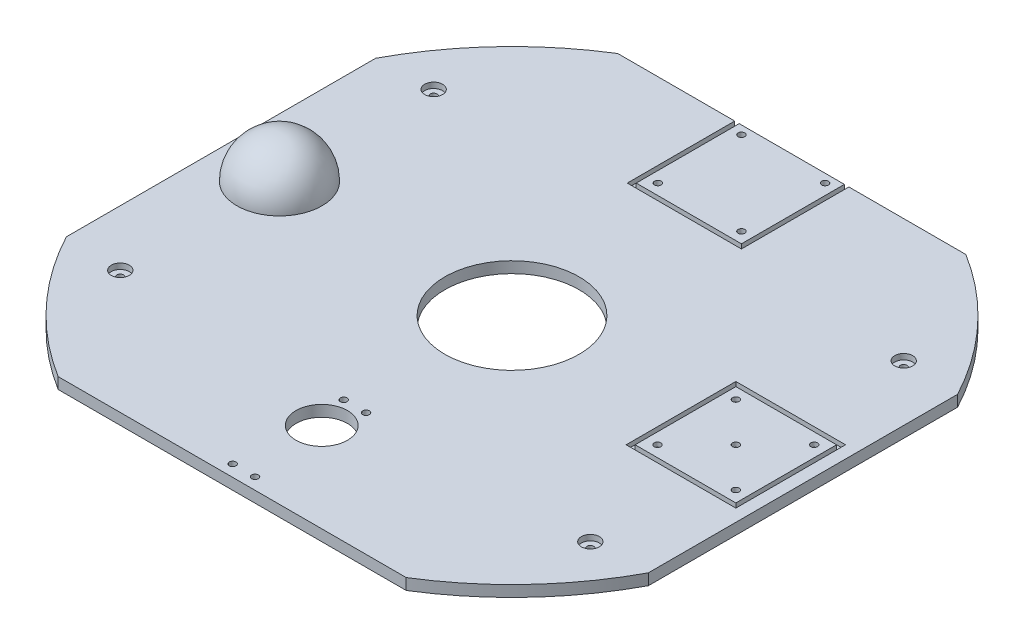
from build123d import *

# Parameters (mm, degrees)
SKETCH_1_W           = 200
SKETCH_1_H           = 150
EXTRUDE_1_DEPTH      = 5
SKETCH_2_W           = 280
SKETCH_2_H           = 250
SKETCH_2_R           = 1.5
EXTRUDE_2_DEPTH      = 5
SKETCH_3_R           = 11.5
CUT_EXTRUDE_1_DEPTH  = 5
SKETCH_4_R           = 3
SKETCH_4_R_2         = 1.5
EXTRUDE_3_DEPTH      = 13
CUT_EXTRUDE_4_REACH  = 190.133
SKETCH_8_R           = 1.5
CUT_EXTRUDE_5_REACH  = 190.133
SKETCH_9_W           = 10
SKETCH_9_H           = 250
SKETCH_10_W          = 41.454704644
SKETCH_10_H          = 62.998147515
CUT_EXTRUDE_6_DEPTH  = 13
CUT_EXTRUDE_7_REACH  = 182.416
SKETCH_11_R          = 1.5
CUT_EXTRUDE_8_DEPTH  = 2
CUT_EXTRUDE_9_REACH  = 182.416
SKETCH_13_R          = 30
CUT_EXTRUDE_10_REACH = 182.416
SKETCH_17_R          = 4
CUT_EXTRUDE_11_DEPTH = 2.5
SKETCH_18_W          = 49
SKETCH_18_H          = 49
SKETCH_18_W_2        = 45
SKETCH_18_H_2        = 45
CUT_EXTRUDE_12_DEPTH = 2
SKETCH_19_R          = 1.5
CUT_EXTRUDE_13_DEPTH = 2


# Read off the part's stored shape, not the designer's step: 旋转4
with BuildPart() as part:
    # 草图1 → 凸台-拉伸1 (new body)
    with BuildSketch(Plane(origin=(0, 0, 0), x_dir=(1, 0, 0), z_dir=(0, 1, 0))):
        Rectangle(SKETCH_1_W, SKETCH_1_H)
    extrude(amount=EXTRUDE_1_DEPTH)

    # 草图2 → 凸台-拉伸2 (add)
    with BuildSketch(Plane(origin=(0, 5, 0), x_dir=(1, 0, 0), z_dir=(0, 1, 0))):
        Rectangle(SKETCH_2_W, SKETCH_2_H)
        with Locations(Location((-105, 70, 0), (0, 0, 270))):
            Circle(SKETCH_2_R, mode=Mode.SUBTRACT)
        with Locations(Location((-105, -70, 0), (0, 0, 270))):
            Circle(SKETCH_2_R, mode=Mode.SUBTRACT)
        with Locations(Location((105, 70, 0), (0, 0, 270))):
            Circle(SKETCH_2_R, mode=Mode.SUBTRACT)
        with Locations(Location((105, -70, 0), (0, 0, 270))):
            Circle(SKETCH_2_R, mode=Mode.SUBTRACT)
    extrude(amount=-EXTRUDE_2_DEPTH)

    # 草图3 → 切除-拉伸1 (cut)
    with BuildSketch(Plane(origin=(0, 5, 0), x_dir=(1, 0, 0), z_dir=(0, 1, 0))):
        with Locations(Location((0, -85, 0), (0, 0, 270))):
            Circle(SKETCH_3_R)
    extrude(amount=-CUT_EXTRUDE_1_DEPTH, mode=Mode.SUBTRACT)

    # 草图4 → 凸台-拉伸3 (add)
    # profile 1 of 4: a face of its own
    with BuildSketch(Plane.XZ):
        with Locations(Location((-5, 119.8, 0), (0, 0, 90))):
            Circle(SKETCH_4_R)
        with Locations(Location((-5, 119.8, 0), (0, 0, 90))):
            Circle(SKETCH_4_R_2, mode=Mode.SUBTRACT)
    # profile 2 of 4: a face of its own
    with BuildSketch(Plane.XZ):
        with Locations(Location((5, 119.8, 0), (0, 0, 90))):
            Circle(SKETCH_4_R)
        with Locations(Location((5, 119.8, 0), (0, 0, 90))):
            Circle(SKETCH_4_R_2, mode=Mode.SUBTRACT)
    # profile 3 of 4: a face of its own
    with BuildSketch(Plane.XZ):
        with Locations(Location((5, 70.2, 0), (0, 0, 90))):
            Circle(SKETCH_4_R)
        with Locations(Location((5, 70.2, 0), (0, 0, 90))):
            Circle(SKETCH_4_R_2, mode=Mode.SUBTRACT)
    # profile 4 of 4: a face of its own
    with BuildSketch(Plane.XZ):
        with Locations(Location((-5, 70.2, 0), (0, 0, 90))):
            Circle(SKETCH_4_R)
        with Locations(Location((-5, 70.2, 0), (0, 0, 90))):
            Circle(SKETCH_4_R_2, mode=Mode.SUBTRACT)
    extrude(amount=EXTRUDE_3_DEPTH)

    # 草图8 → 切除-拉伸4 (cut, up to next)
    with BuildSketch(Plane.XZ, mode=Mode.PRIVATE) as cut_extrude_4_sk1:
        with Locations(Location((5, 119.8, 0), (0, 0, 90))):
            Circle(SKETCH_8_R)
    cut_extrude_4_tool1 = extrude(cut_extrude_4_sk1.sketch, amount=-CUT_EXTRUDE_4_REACH, mode=Mode.PRIVATE) & part.part
    # 草图8 → 切除-拉伸4 (cut, up to next)
    with BuildSketch(Plane.XZ, mode=Mode.PRIVATE) as cut_extrude_4_sk2:
        with Locations(Location((5, 70.2, 0), (0, 0, 90))):
            Circle(SKETCH_8_R)
    cut_extrude_4_tool2 = extrude(cut_extrude_4_sk2.sketch, amount=-CUT_EXTRUDE_4_REACH, mode=Mode.PRIVATE) & part.part
    # 草图8 → 切除-拉伸4 (cut, up to next)
    with BuildSketch(Plane.XZ, mode=Mode.PRIVATE) as cut_extrude_4_sk3:
        with Locations(Location((-5, 119.8, 0), (0, 0, 90))):
            Circle(SKETCH_8_R)
    cut_extrude_4_tool3 = extrude(cut_extrude_4_sk3.sketch, amount=-CUT_EXTRUDE_4_REACH, mode=Mode.PRIVATE) & part.part
    # 草图8 → 切除-拉伸4 (cut, up to next)
    with BuildSketch(Plane.XZ, mode=Mode.PRIVATE) as cut_extrude_4_sk4:
        with Locations(Location((-5, 70.2, 0), (0, 0, 90))):
            Circle(SKETCH_8_R)
    cut_extrude_4_tool4 = extrude(cut_extrude_4_sk4.sketch, amount=-CUT_EXTRUDE_4_REACH, mode=Mode.PRIVATE) & part.part
    add(cut_extrude_4_tool1.solids().sort_by_distance((5, 0, 119.8))[0], mode=Mode.SUBTRACT)
    add(cut_extrude_4_tool2.solids().sort_by_distance((5, 0, 70.2))[0], mode=Mode.SUBTRACT)
    add(cut_extrude_4_tool3.solids().sort_by_distance((-5, 0, 119.8))[0], mode=Mode.SUBTRACT)
    add(cut_extrude_4_tool4.solids().sort_by_distance((-5, 0, 70.2))[0], mode=Mode.SUBTRACT)

    # 草图9 → 切除-拉伸5 (cut, up to next)
    with BuildSketch(Plane.XZ, mode=Mode.PRIVATE) as cut_extrude_5_sk1:
        with Locations((-135, 0)):
            Rectangle(SKETCH_9_W, SKETCH_9_H)
    cut_extrude_5_tool1 = extrude(cut_extrude_5_sk1.sketch, amount=-CUT_EXTRUDE_5_REACH, mode=Mode.PRIVATE) & part.part
    # 草图9 → 切除-拉伸5 (cut, up to next)
    with BuildSketch(Plane.XZ, mode=Mode.PRIVATE) as cut_extrude_5_sk2:
        with Locations((135, 0)):
            Rectangle(SKETCH_9_W, SKETCH_9_H)
    cut_extrude_5_tool2 = extrude(cut_extrude_5_sk2.sketch, amount=-CUT_EXTRUDE_5_REACH, mode=Mode.PRIVATE) & part.part
    add(cut_extrude_5_tool1.solids().sort_by_distance((-135, 0, 0))[0], mode=Mode.SUBTRACT)
    add(cut_extrude_5_tool2.solids().sort_by_distance((135, 0, 0))[0], mode=Mode.SUBTRACT)

    # 草图10 → 切除-拉伸6 (cut)
    with BuildSketch(Plane.XZ):
        with Locations((1.571094054, 93.500926243)):
            Rectangle(SKETCH_10_W, SKETCH_10_H)
    extrude(amount=CUT_EXTRUDE_6_DEPTH, mode=Mode.SUBTRACT)

    # 草图11 → 切除-拉伸7 (cut, up to next)
    with BuildSketch(Plane(origin=(0, 5, 0), x_dir=(1, 0, 0), z_dir=(0, 1, 0)), mode=Mode.PRIVATE) as cut_extrude_7_sk1:
        with Locations(Location((-18.68, 121.18, 0), (0, 0, 270))):
            Circle(SKETCH_11_R)
    cut_extrude_7_tool1 = extrude(cut_extrude_7_sk1.sketch, amount=-CUT_EXTRUDE_7_REACH, mode=Mode.PRIVATE) & part.part
    # 草图11 → 切除-拉伸7 (cut, up to next)
    with BuildSketch(Plane(origin=(0, 5, 0), x_dir=(1, 0, 0), z_dir=(0, 1, 0)), mode=Mode.PRIVATE) as cut_extrude_7_sk2:
        with Locations(Location((18.68, 121.18, 0), (0, 0, 270))):
            Circle(SKETCH_11_R)
    cut_extrude_7_tool2 = extrude(cut_extrude_7_sk2.sketch, amount=-CUT_EXTRUDE_7_REACH, mode=Mode.PRIVATE) & part.part
    # 草图11 → 切除-拉伸7 (cut, up to next)
    with BuildSketch(Plane(origin=(0, 5, 0), x_dir=(1, 0, 0), z_dir=(0, 1, 0)), mode=Mode.PRIVATE) as cut_extrude_7_sk3:
        with Locations(Location((18.68, 83.82, 0), (0, 0, 270))):
            Circle(SKETCH_11_R)
    cut_extrude_7_tool3 = extrude(cut_extrude_7_sk3.sketch, amount=-CUT_EXTRUDE_7_REACH, mode=Mode.PRIVATE) & part.part
    # 草图11 → 切除-拉伸7 (cut, up to next)
    with BuildSketch(Plane(origin=(0, 5, 0), x_dir=(1, 0, 0), z_dir=(0, 1, 0)), mode=Mode.PRIVATE) as cut_extrude_7_sk4:
        with Locations(Location((-18.68, 83.82, 0), (0, 0, 270))):
            Circle(SKETCH_11_R)
    cut_extrude_7_tool4 = extrude(cut_extrude_7_sk4.sketch, amount=-CUT_EXTRUDE_7_REACH, mode=Mode.PRIVATE) & part.part
    add(cut_extrude_7_tool1.solids().sort_by_distance((-18.68, 5, -121.18))[0], mode=Mode.SUBTRACT)
    add(cut_extrude_7_tool2.solids().sort_by_distance((18.68, 5, -121.18))[0], mode=Mode.SUBTRACT)
    add(cut_extrude_7_tool3.solids().sort_by_distance((18.68, 5, -83.82))[0], mode=Mode.SUBTRACT)
    add(cut_extrude_7_tool4.solids().sort_by_distance((-18.68, 5, -83.82))[0], mode=Mode.SUBTRACT)

    # 草图12 → 切除-拉伸8 (cut)
    with BuildSketch(Plane(origin=(0, 5, 0), x_dir=(1, 0, 0), z_dir=(0, 1, 0))):
        Polygon((-23.5, 79), (23.5, 79), (23.5, 125), (25.5, 125), (25.5, 77), (-25.5, 77), (-25.5, 125), (-23.5, 125), align=None)
    extrude(amount=-CUT_EXTRUDE_8_DEPTH, mode=Mode.SUBTRACT)

    # 草图13 → 切除-拉伸9 (cut, up to next)
    with BuildSketch(Plane(origin=(0, 5, 0), x_dir=(1, 0, 0), z_dir=(0, 1, 0)), mode=Mode.PRIVATE) as cut_extrude_9_sk1:
        with Locations(Location((0, 0, 0), (0, 0, 270))):
            Circle(SKETCH_13_R)
    cut_extrude_9_tool1 = extrude(cut_extrude_9_sk1.sketch, amount=-CUT_EXTRUDE_9_REACH, mode=Mode.PRIVATE) & part.part
    add(cut_extrude_9_tool1.solids().sort_by_distance((0, 5, 0))[0], mode=Mode.SUBTRACT)

    # 草图14 → 切除-拉伸10 (cut, up to next)
    with BuildSketch(Plane(origin=(0, 5, 0), x_dir=(1, 0, 0), z_dir=(0, 1, 0)), mode=Mode.PRIVATE) as cut_extrude_10_sk1:
        with BuildLine():
            Line((77.75, 125), (130, 125))
            Line((130, 125), (130, 69.065639069))
            ThreePointArc((130, 69.065639069), (107.574061968, 100.488226633), (77.75, 125))
        make_face()
    cut_extrude_10_tool1 = extrude(cut_extrude_10_sk1.sketch, amount=-CUT_EXTRUDE_10_REACH, mode=Mode.PRIVATE) & part.part
    # 草图14 → 切除-拉伸10 (cut, up to next)
    with BuildSketch(Plane(origin=(0, 5, 0), x_dir=(1, 0, 0), z_dir=(0, 1, 0)), mode=Mode.PRIVATE) as cut_extrude_10_sk2:
        with BuildLine():
            Line((77.75, -125), (130, -125))
            Line((130, -125), (130, -69.065639069))
            ThreePointArc((130, -69.065639069), (107.574061968, -100.488226633), (77.75, -125))
        make_face()
    cut_extrude_10_tool2 = extrude(cut_extrude_10_sk2.sketch, amount=-CUT_EXTRUDE_10_REACH, mode=Mode.PRIVATE) & part.part
    # 草图14 → 切除-拉伸10 (cut, up to next)
    with BuildSketch(Plane(origin=(0, 5, 0), x_dir=(1, 0, 0), z_dir=(0, 1, 0)), mode=Mode.PRIVATE) as cut_extrude_10_sk3:
        with BuildLine():
            Line((-130, -125), (-130, -69.065639069))
            ThreePointArc((-130, -69.065639069), (-107.574061968, -100.488226633), (-77.75, -125))
            Line((-77.75, -125), (-130, -125))
        make_face()
    cut_extrude_10_tool3 = extrude(cut_extrude_10_sk3.sketch, amount=-CUT_EXTRUDE_10_REACH, mode=Mode.PRIVATE) & part.part
    # 草图14 → 切除-拉伸10 (cut, up to next)
    with BuildSketch(Plane(origin=(0, 5, 0), x_dir=(1, 0, 0), z_dir=(0, 1, 0)), mode=Mode.PRIVATE) as cut_extrude_10_sk4:
        with BuildLine():
            Line((-130, 125), (-130, 69.065639069))
            ThreePointArc((-130, 69.065639069), (-107.574061968, 100.488226633), (-77.75, 125))
            Line((-77.75, 125), (-130, 125))
        make_face()
    cut_extrude_10_tool4 = extrude(cut_extrude_10_sk4.sketch, amount=-CUT_EXTRUDE_10_REACH, mode=Mode.PRIVATE) & part.part
    add(cut_extrude_10_tool1.solids().sort_by_distance((114.14156, 5, -108.066894))[0], mode=Mode.SUBTRACT)
    add(cut_extrude_10_tool2.solids().sort_by_distance((114.14156, 5, 108.066894))[0], mode=Mode.SUBTRACT)
    add(cut_extrude_10_tool3.solids().sort_by_distance((-114.14156, 5, 108.066894))[0], mode=Mode.SUBTRACT)
    add(cut_extrude_10_tool4.solids().sort_by_distance((-114.14156, 5, -108.066894))[0], mode=Mode.SUBTRACT)

    # 旋转4 outline → 旋转4 (revolve)
    with BuildSketch(Plane(origin=(-103.875, 0, 0), x_dir=(1, 0, 0), z_dir=(0, 0, 1))):
        with BuildLine():
            Line((0, 4.999999981), (19, 4.999999981))
            ThreePointArc((19, 4.999999981), (13.435028849, 18.435028836), (0, 24))
            Line((0, 24), (0, 4.999999981))
        make_face()
    revolve(axis=Axis((-103.875, 0, 0), (0, 1, 0)))

    # 草图17 → 切除-拉伸11 (cut)
    with BuildSketch(Plane(origin=(0, 5, 0), x_dir=(1, 0, 0), z_dir=(0, 1, 0))):
        with Locations(Location((-105, 70, 0), (0, 0, 270))):
            Circle(SKETCH_17_R)
        with Locations(Location((105, 70, 0), (0, 0, 270))):
            Circle(SKETCH_17_R)
        with Locations(Location((105, -70, 0), (0, 0, 270))):
            Circle(SKETCH_17_R)
        with Locations(Location((-105, -70, 0), (0, 0, 270))):
            Circle(SKETCH_17_R)
    extrude(amount=-CUT_EXTRUDE_11_DEPTH, mode=Mode.SUBTRACT)

    # 草图18 → 切除-拉伸12 (cut)
    with BuildSketch(Plane(origin=(0, 5, 0), x_dir=(1, 0, 0), z_dir=(0, 1, 0))):
        with Locations((100, 0)):
            Rectangle(SKETCH_18_W, SKETCH_18_H)
        with Locations((100, 0)):
            Rectangle(SKETCH_18_W_2, SKETCH_18_H_2, mode=Mode.SUBTRACT)
    extrude(amount=-CUT_EXTRUDE_12_DEPTH, mode=Mode.SUBTRACT)

    # 草图19 → 切除-拉伸13 (cut)
    with BuildSketch(Plane(origin=(0, 5, 0), x_dir=(1, 0, 0), z_dir=(0, 1, 0))):
        with Locations(Location((117.5, 17.5, 0), (0, 0, 270))):
            Circle(SKETCH_19_R)
        with Locations(Location((82.5, 17.5, 0), (0, 0, 270))):
            Circle(SKETCH_19_R)
        with Locations(Location((117.5, -17.5, 0), (0, 0, 270))):
            Circle(SKETCH_19_R)
        with Locations(Location((82.5, -17.5, 0), (0, 0, 270))):
            Circle(SKETCH_19_R)
        with Locations(Location((100, 0, 0), (0, 0, 270))):
            Circle(SKETCH_19_R)
    extrude(amount=-CUT_EXTRUDE_13_DEPTH, mode=Mode.SUBTRACT)


solid = part.part
